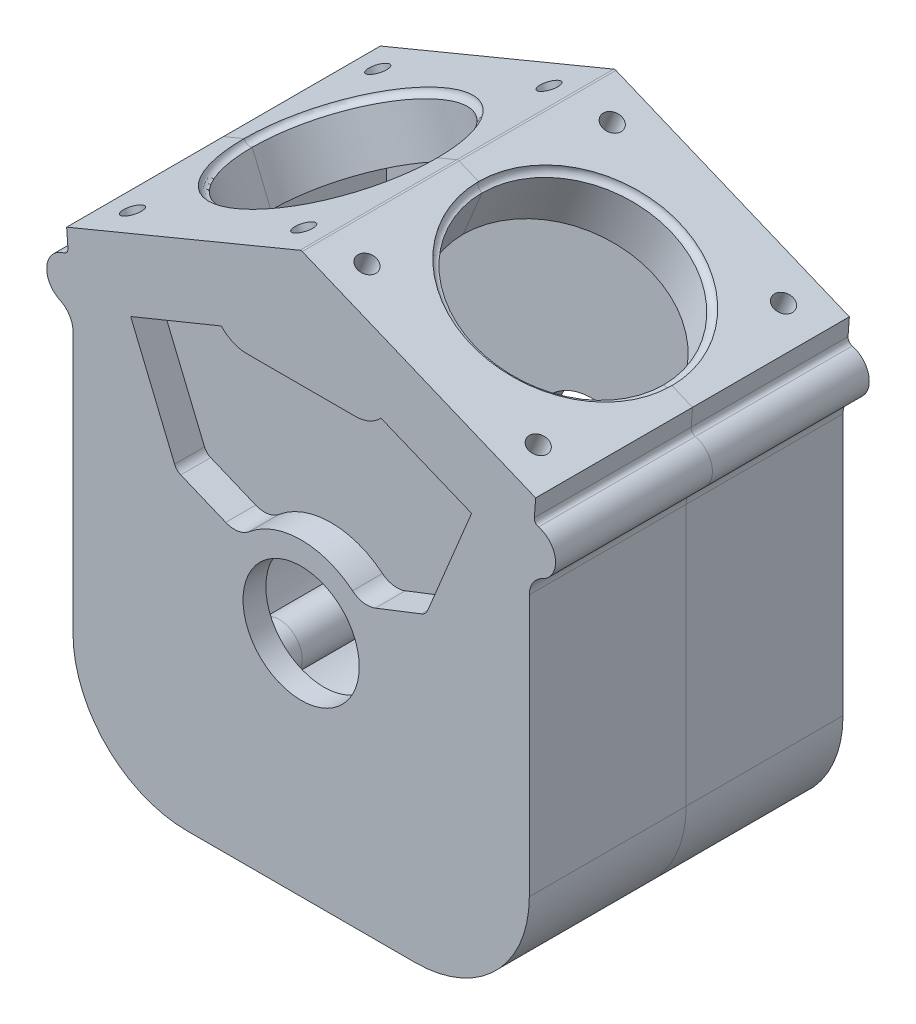
from build123d import *
from build123d.topology import SkipClean

# Parameters (mm, degrees)
BOSS_EXTRUDE1_DEPTH                  = 87.3125
CUT_EXTRUDE1_DEPTH                   = 74.6125
CUT_EXTRUDE2_REACH                   = 364.498
SKETCH4_R                            = 54.76875
SKETCH5_R                            = 32.34563
CUT_EXTRUDE3_DEPTH                   = 291.909307414
BOSS_EXTRUDE2_START                  = -12.7
BOSS_EXTRUDE2_DEPTH                  = 16.66875
CUT_EXTRUDE5_DEPTH                   = 16.66875
TAP_DRILL_FOR_1_2_13_TAP2_AT_2_COUNT = 2
TAP_DRILL_FOR_1_2_13_TAP2_AT_2_PITCH = 103.1875
TAP_DRILL_FOR_1_2_13_TAP2_AT_3_COUNT = 2
TAP_DRILL_FOR_1_2_13_TAP2_AT_3_PITCH = 171.133678104
TAP_DRILL_FOR_1_2_13_TAP2_AT_4_COUNT = 2
TAP_DRILL_FOR_1_2_13_TAP2_AT_4_PITCH = 136.525
SKETCH12_R                           = 58.26125
SKETCH12_R_2                         = 54.76875
CUT_EXTRUDE6_DEPTH                   = 3.4925
FILLET3_R                            = 1.5875
FILLET4_R                            = 3.4925
FILLET4_OF_MIRROR2_R                 = 3.4925


with BuildPart() as part:
    # Sketch1 → Boss-Extrude1 (new, symmetric)
    with BuildSketch(Plane.XY):
        with BuildLine():
            Line((-63.5, -127), (63.5, -127))
            ThreePointArc((63.5, -127), (108.401280605, -108.401280605), (127, -63.5))
            Line((127, -63.5), (127, 82.014571468))
            ThreePointArc((127, 82.014571468), (128.982488633, 88.828157168), (134.311015762, 93.51452142))
            ThreePointArc((134.311015762, 93.51452142), (141.570363806, 106.158888477), (132.159372053, 117.29492846))
            ThreePointArc((132.159372053, 117.29492846), (130.384327695, 118.520697957), (129.802252607, 120.597831059))
            Line((129.802252607, 120.597831059), (130.53262945, 130.53262945))
            Line((130.53262945, 130.53262945), (0, 184.6010149))
            Line((0, 184.6010149), (-130.53262945, 130.53262945))
            Line((-130.53262945, 130.53262945), (-129.802252607, 120.597831059))
            ThreePointArc((-129.802252607, 120.597831059), (-130.384327695, 118.520697957), (-132.159372053, 117.29492846))
            ThreePointArc((-132.159372053, 117.29492846), (-141.570363806, 106.158888477), (-134.311015762, 93.51452142))
            ThreePointArc((-134.311015762, 93.51452142), (-128.982488633, 88.828157168), (-127, 82.014571468))
            Line((-127, 82.014571468), (-127, -63.5))
            ThreePointArc((-127, -63.5), (-108.401280605, -108.401280605), (-63.5, -127))
        make_face()
    extrude(amount=BOSS_EXTRUDE1_DEPTH, both=True)

    # Sketch3 → Cut-Extrude1 (cut, symmetric)
    with BuildSketch(Plane.XY):
        with BuildLine():
            Line((-63.5, -114.3), (63.5, -114.3))
            ThreePointArc((63.5, -114.3), (76.921207893, -112.495011773), (89.388670817, -107.208314121))
            ThreePointArc((89.388670817, -107.208314121), (90.440768363, -90.440768363), (107.208314121, -89.388670817))
            ThreePointArc((107.208314121, -89.388670817), (112.495011773, -76.921207893), (114.3, -63.5))
            Line((114.3, -63.5), (114.3, 104.069705413))
            Line((114.3, 104.069705413), (0, 151.414315592))
            Line((0, 151.414315592), (-114.3, 104.069705413))
            Line((-114.3, 104.069705413), (-114.3, -63.5))
            ThreePointArc((-114.3, -63.5), (-112.495011773, -76.921207893), (-107.208314121, -89.388670817))
            ThreePointArc((-107.208314121, -89.388670817), (-90.440768363, -90.440768363), (-89.388670817, -107.208314121))
            ThreePointArc((-89.388670817, -107.208314121), (-76.921207893, -112.495011773), (-63.5, -114.3))
        make_face()
    extrude(amount=CUT_EXTRUDE1_DEPTH, both=True, mode=Mode.SUBTRACT)

    # Sketch4 → Cut-Extrude2 (cut, up to next)
    with BuildSketch(Plane(origin=(-65.266314725, 157.566822175, 0), x_dir=(0.9238795325112863, 0.3826834323650909, 0), z_dir=(-0.3826834323650909, 0.9238795325112863, 0)), mode=Mode.PRIVATE) as cut_extrude2_sk1:
        with Locations(Location((0, 0, 0), (0, 0, 180))):
            Circle(SKETCH4_R)
    cut_extrude2_tool1 = extrude(cut_extrude2_sk1.sketch, amount=-CUT_EXTRUDE2_REACH, mode=Mode.PRIVATE) & part.part
    cut_extrude2 = cut_extrude2_tool1.solids().sort_by_distance((-65.266315, 157.566822, 0))[0]
    add(cut_extrude2, mode=Mode.SUBTRACT)

    # Sketch5 → Cut-Extrude3 (cut, through all)
    with BuildSketch(Plane.XY.offset(87.3125)):
        Circle(SKETCH5_R)
    extrude(amount=-CUT_EXTRUDE3_DEPTH, mode=Mode.SUBTRACT)

    # Sketch6 → Boss-Extrude2 (add)
    with SkipClean():  # the faces are left unmerged after this step: merging them gives an invalid solid
        with BuildSketch(Plane.XY.offset(87.3125).offset(BOSS_EXTRUDE2_START)):
            with BuildLine():
                Line((-103.168245091, 108.680629269), (-76.318963971, 43.86073065))
                ThreePointArc((-76.318963971, 43.86073065), (-73.565950029, 39.74055412), (-69.445773499, 36.987540178))
                Line((-69.445773499, 36.987540178), (-34.24596331, 22.407301405))
                ThreePointArc((-34.24596331, 22.407301405), (-27.375127797, 21.600760439), (-21.100935252, 24.515103744))
                ThreePointArc((-21.100935252, 24.515103744), (0, 32.34563), (21.100935252, 24.515103744))
                ThreePointArc((21.100935252, 24.515103744), (27.375127797, 21.600760439), (34.24596331, 22.407301405))
                Line((34.24596331, 22.407301405), (69.445773499, 36.987540178))
                ThreePointArc((69.445773499, 36.987540178), (73.565950029, 39.74055412), (76.318963971, 43.86073065))
                Line((76.318963971, 43.86073065), (103.168245091, 108.680629269))
                Line((103.168245091, 108.680629269), (42.097137505, 133.977110301))
                ThreePointArc((42.097137505, 133.977110301), (37.346298964, 128.18819679), (30.179973057, 126.014315592))
                Line((30.179973057, 126.014315592), (-30.179973057, 126.014315592))
                ThreePointArc((-30.179973057, 126.014315592), (-37.346298964, 128.18819679), (-42.097137505, 133.977110301))
                Line((-42.097137505, 133.977110301), (-103.168245091, 108.680629269))
            make_face()
        extrude(amount=-BOSS_EXTRUDE2_DEPTH)

    # Sketch7 → Cut-Extrude5 (cut)
    with SkipClean():  # the faces are left unmerged after this step: merging them gives an invalid solid
        with BuildSketch(Plane.XY.offset(87.3125)):
            with BuildLine():
                Line((41.286964233, 32.788474366), (66.898948335, 42.807151986))
                ThreePointArc((66.898948335, 42.807151986), (69.031090097, 44.186391566), (70.45232894, 46.290770445))
                Line((70.45232894, 46.290770445), (94.880793186, 105.266300136))
                Line((94.880793186, 105.266300136), (44.400899101, 125.940658233))
                ThreePointArc((44.400899101, 125.940658233), (37.952154451, 121.303166596), (30.179973057, 119.664315592))
                Line((30.179973057, 119.664315592), (-30.179973057, 119.664315592))
                ThreePointArc((-30.179973057, 119.664315592), (-37.952154451, 121.303166596), (-44.400899101, 125.940658233))
                Line((-44.400899101, 125.940658233), (-94.880793186, 105.266300136))
                Line((-94.880793186, 105.266300136), (-70.45232894, 46.290770445))
                ThreePointArc((-70.45232894, 46.290770445), (-69.075821969, 44.23068218), (-67.015733704, 42.854175209))
                Line((-67.015733704, 42.854175209), (-41.993520552, 32.489635161))
                ThreePointArc((-41.993520552, 32.489635161), (-35.199307828, 31.671047632), (-28.966680979, 34.496958926))
                ThreePointArc((-28.966680979, 34.496958926), (-0.239823776, 45.044991582), (28.597719146, 34.803437212))
                ThreePointArc((28.597719146, 34.803437212), (34.668739167, 32.072941657), (41.286964233, 32.788474366))
            make_face()
        extrude(amount=-CUT_EXTRUDE5_DEPTH, mode=Mode.SUBTRACT)

    # Sketch11 → Tap Drill for 1/2-13 Tap2 (revolve, cut)
    with SkipClean():  # the faces are left unmerged after this step: merging them gives an invalid solid
        with BuildSketch(Plane(origin=(-112.932724355, 137.822748836, -68.2625), x_dir=(-0.9238795325112863, -0.38268343236509084, 0), z_dir=(0, 0, 1))):
            Polygon((0, 0), (0, 22.269489309), (5.35813, 19.05), (5.35813, 0), align=None)
        tap_drill_for_1_2_13_tap2 = revolve(axis=Axis((-115.362764151, 143.689383868, -68.2625), (0.3826834323650909, -0.9238795325112864, 0)), mode=Mode.SUBTRACT)

    # Tap Drill for 1/2-13 Tap2 at 2: Tap Drill for 1/2-13 Tap2 ×2
    with SkipClean():  # the faces are left unmerged after this step: merging them gives an invalid solid
        with Locations(*[Vector(0.9238795325112863, 0.38268343236509084, 0) * (i * TAP_DRILL_FOR_1_2_13_TAP2_AT_2_PITCH) for i in range(1, TAP_DRILL_FOR_1_2_13_TAP2_AT_2_COUNT)]):
            add(tap_drill_for_1_2_13_tap2, mode=Mode.SUBTRACT)

    # Tap Drill for 1/2-13 Tap2 at 3: Tap Drill for 1/2-13 Tap2 ×2
    with SkipClean():  # the faces are left unmerged after this step: merging them gives an invalid solid
        with Locations(*[Vector(0.5570663841124427, 0.23074445144151456, 0.7977681629526483) * (i * TAP_DRILL_FOR_1_2_13_TAP2_AT_3_PITCH) for i in range(1, TAP_DRILL_FOR_1_2_13_TAP2_AT_3_COUNT)]):
            add(tap_drill_for_1_2_13_tap2, mode=Mode.SUBTRACT)

    # Tap Drill for 1/2-13 Tap2 at 4: Tap Drill for 1/2-13 Tap2 ×2
    with SkipClean():  # the faces are left unmerged after this step: merging them gives an invalid solid
        with Locations(*[(0, 0, i * TAP_DRILL_FOR_1_2_13_TAP2_AT_4_PITCH) for i in range(1, TAP_DRILL_FOR_1_2_13_TAP2_AT_4_COUNT)]):
            add(tap_drill_for_1_2_13_tap2, mode=Mode.SUBTRACT)

    # Sketch12 → Cut-Extrude6 (cut)
    with SkipClean():  # the faces are left unmerged after this step: merging them gives an invalid solid
        with BuildSketch(Plane(origin=(-65.266314725, 157.566822175, 0), x_dir=(0.9238795325112854, 0.38268343236509295, 0), z_dir=(-0.38268343236509295, 0.9238795325112854, 0))):
            with Locations(Location((0, 0, 0), (0, 0, 180))):
                Circle(SKETCH12_R)
            with Locations(Location((0, 0, 0), (0, 0, 180))):
                Circle(SKETCH12_R_2, mode=Mode.SUBTRACT)
        cut_extrude6 = extrude(amount=-CUT_EXTRUDE6_DEPTH, mode=Mode.SUBTRACT)

    # Fillet3
    fillet3_edges = [part.edges().sort_by_distance(p)[0] for p in [
        (0, 184.6010149, 0),
    ]]
    fillet(fillet3_edges, radius=FILLET3_R)

    # Fillet4
    fillet4_edges = [part.edges().sort_by_distance(p)[0] for p in [
        (-10.103416424, 176.635788031, 0),
    ]]
    fillet(fillet4_edges, radius=FILLET4_R - 0.0001)  # a hair under: the kernel refuses the full size

    # Mirror2: Cut-Extrude2, Tap Drill for 1/2-13 Tap2, Cut-Extrude6 across plane
    add(cut_extrude2.mirror(Plane(origin=(0, 0, 0), x_dir=(0, 0, 1), z_dir=(1, 0, 0))), mode=Mode.SUBTRACT)
    add(tap_drill_for_1_2_13_tap2.mirror(Plane(origin=(0, 0, 0), x_dir=(0, 0, 1), z_dir=(1, 0, 0))), mode=Mode.SUBTRACT)
    add(cut_extrude6.mirror(Plane(origin=(0, 0, 0), x_dir=(0, 0, 1), z_dir=(1, 0, 0))), mode=Mode.SUBTRACT)

    # Mirror2 copy 1 sketch → Mirror2 copy 1 (revolve, cut)
    with BuildSketch(Plane(origin=(17.599905094, 177.310895513, -68.2625), x_dir=(0.9238795325112863, -0.38268343236509084, 0), z_dir=(0, 0, 1))):
        Polygon((0, 0), (0, -22.269489309), (5.35813, -19.05), (5.35813, 0), align=None)
    revolve(axis=Axis((20.02994489, 183.177530545, -68.2625), (0.3826834323650909, 0.9238795325112864, 0)), mode=Mode.SUBTRACT)

    # Mirror2 copy 2 sketch → Mirror2 copy 2 (revolve, cut)
    with BuildSketch(Plane(origin=(17.599905094, 177.310895513, 68.2625), x_dir=(0.9238795325112863, -0.38268343236509084, 0), z_dir=(0, 0, 1))):
        Polygon((0, 0), (0, -22.269489309), (5.35813, -19.05), (5.35813, 0), align=None)
    revolve(axis=Axis((20.02994489, 183.177530545, 68.2625), (0.3826834323650909, 0.9238795325112864, 0)), mode=Mode.SUBTRACT)

    # Mirror2 copy 3 sketch → Mirror2 copy 3 (revolve, cut)
    with BuildSketch(Plane(origin=(112.932724355, 137.822748836, 68.2625), x_dir=(0.9238795325112863, -0.38268343236509084, 0), z_dir=(0, 0, 1))):
        Polygon((0, 0), (0, -22.269489309), (5.35813, -19.05), (5.35813, 0), align=None)
    revolve(axis=Axis((115.362764151, 143.689383868, 68.2625), (0.3826834323650909, 0.9238795325112864, 0)), mode=Mode.SUBTRACT)

    # Fillet4 of Mirror2
    fillet4_of_mirror2_edges = [part.edges().sort_by_distance(p)[0] for p in [
        (10.103416424, 176.635788031, 0),
    ]]
    fillet(fillet4_of_mirror2_edges, radius=FILLET4_OF_MIRROR2_R - 0.0001)  # a hair under: the kernel refuses the full size


with BuildPart() as body_2:
    # Split1: the piece on the far side of the plane
    add(part.part)
    split(bisect_by=Plane.XY, keep=Keep.BOTTOM)


with BuildPart() as part_1:
    add(part.part)

    # Split1
    split(bisect_by=Plane.XY, keep=Keep.TOP)


solid = Compound([body_2.part, part_1.part])
